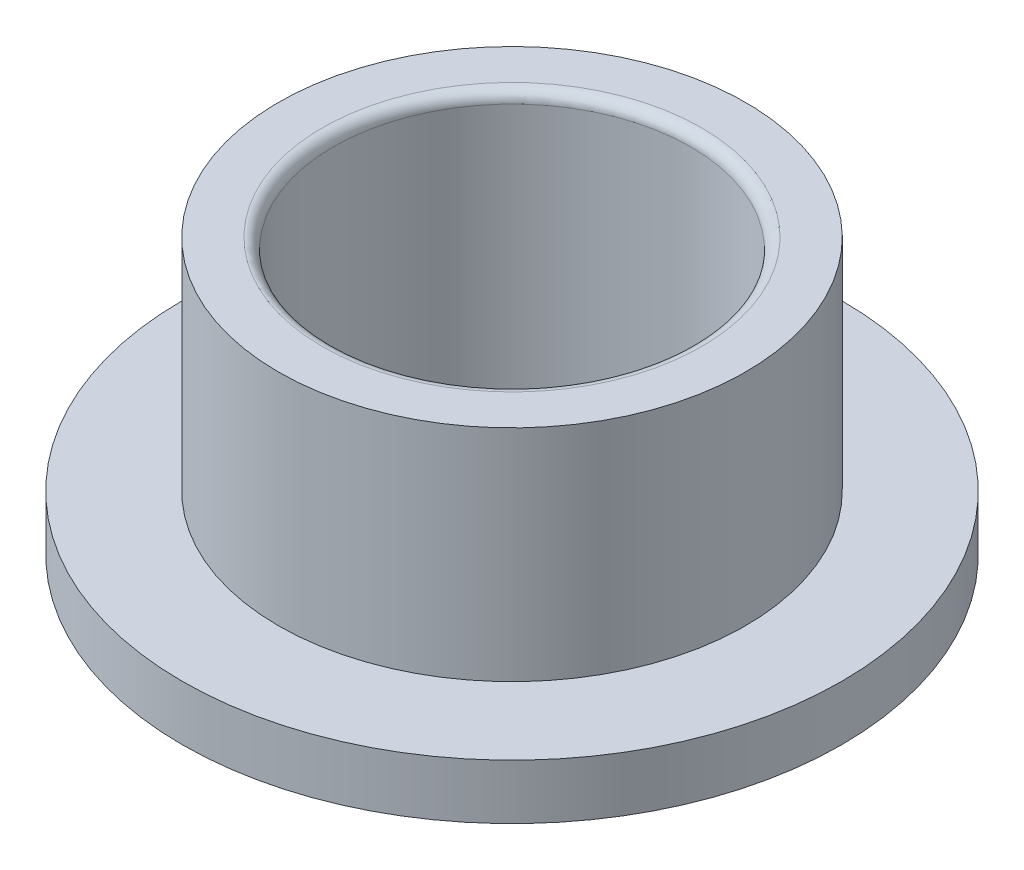
from build123d import *

# Parameters (mm, degrees)
SKETCH1_R           = 21.25
SKETCH1_R_2         = 16.25
BOSS_EXTRUDE1_DEPTH = 20
FILLET1_R           = 1
BOSS_EXTRUDE2_START = 5
SKETCH2_R           = 30
SKETCH2_R_2         = 16.25
BOSS_EXTRUDE2_DEPTH = 5
FILLET2_R           = 1


with BuildPart() as part:
    # Sketch1 → Boss-Extrude1 (new body)
    with BuildSketch(Plane(origin=(0, 0, 0), x_dir=(1, 0, 0), z_dir=(0, 1, 0))):
        Circle(SKETCH1_R)
        Circle(SKETCH1_R_2, mode=Mode.SUBTRACT)
    extrude(amount=BOSS_EXTRUDE1_DEPTH)

    # Fillet1
    fillet1_edges = [part.edges().sort_by_distance(p)[0] for p in [
        (-16.25, 20, 0),
    ]]
    fillet(fillet1_edges, radius=FILLET1_R)

    # Sketch2 → Boss-Extrude2 (add)
    with BuildSketch(Plane.XZ.offset(BOSS_EXTRUDE2_START)):
        Circle(SKETCH2_R)
        Circle(SKETCH2_R_2, mode=Mode.SUBTRACT)
    extrude(amount=-BOSS_EXTRUDE2_DEPTH)

    # Fillet2
    fillet2_edges = [part.edges().sort_by_distance(p)[0] for p in [
        (-16.25, -5, 0),
    ]]
    fillet(fillet2_edges, radius=FILLET2_R)


solid = part.part
